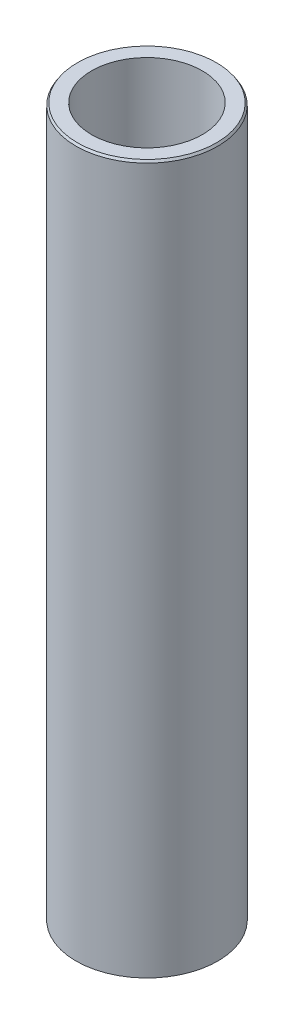
from build123d import *
from OCP.BRepFilletAPI import BRepFilletAPI_MakeChamfer

# Parameters (mm, degrees)
SKETCH1_R           = 60
BOSS_EXTRUDE1_DEPTH = 600
SKETCH2_R           = 46.83705123
CUT_EXTRUDE1_DEPTH  = 606.970296302
CHAMFER1_SIZE       = 1.853365482
CHAMFER1_SIZE2      = 1.233218696


with BuildPart() as part:
    # Sketch1 → Boss-Extrude1 (new body)
    with BuildSketch(Plane(origin=(0, 0, 0), x_dir=(1, 0, 0), z_dir=(0, 1, 0))):
        Circle(SKETCH1_R)
    extrude(amount=BOSS_EXTRUDE1_DEPTH)

    # Sketch2 → Cut-Extrude1 (cut, through all)
    with BuildSketch(Plane(origin=(0, 0, 0), x_dir=(1, 0, 0), z_dir=(0, 1, 0))):
        Circle(SKETCH2_R)
    extrude(amount=CUT_EXTRUDE1_DEPTH, mode=Mode.SUBTRACT)

    # Chamfer1: one chamfer whose edges measure the first distance from different faces: ONE call of the kernel's chamfer builder (chamfer() names one face for all edges)
    chamfer1_edges_1 = [part.edges().sort_by_distance(p)[0] for p in [
        (-60, 600, 0),
    ]]
    chamfer1_side_1 = [part.faces().sort_by_distance(p)[0] for p in [
        (-60, 300, 0),
    ]]
    chamfer1_edges_2 = [part.edges().sort_by_distance(p)[0] for p in [
        (-60, 0, 0),
    ]]
    chamfer1_side_2 = [part.faces().sort_by_distance(p)[0] for p in [
        (-58.302943725, 0, 0),
    ]]
    chamfer1 = BRepFilletAPI_MakeChamfer(part.part.solid().wrapped)
    for e in chamfer1_edges_1:
        chamfer1.Add(CHAMFER1_SIZE, CHAMFER1_SIZE2, e.wrapped, chamfer1_side_1[0].wrapped)  # the first distance lies on this face
    for e in chamfer1_edges_2:
        chamfer1.Add(CHAMFER1_SIZE, CHAMFER1_SIZE2, e.wrapped, chamfer1_side_2[0].wrapped)  # the first distance lies on this face
    add(Compound.cast(chamfer1.Shape()), mode=Mode.REPLACE)


solid = part.part
